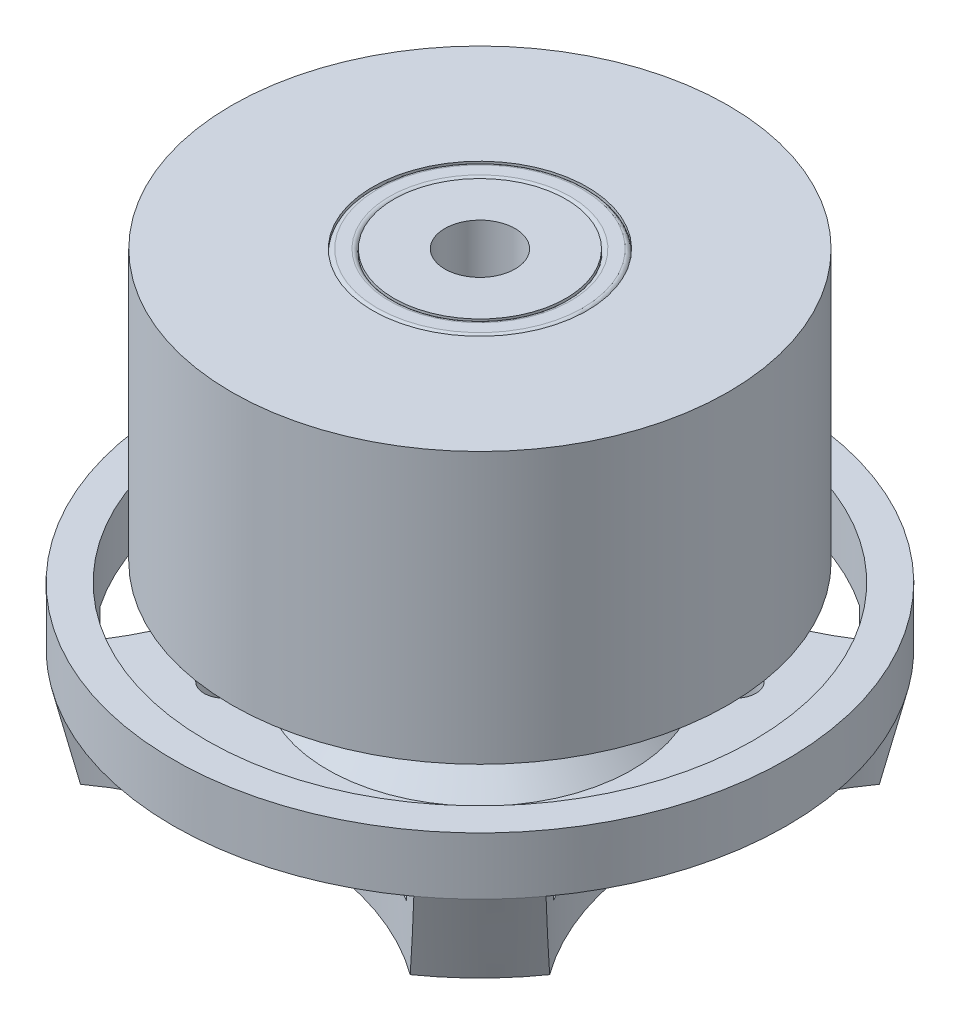
from build123d import *

# Parameters (mm, degrees)
SKETCH2_R                       = 3.4925
CUT_EXTRUDE1_DEPTH              = 5.08
SKETCH3_R                       = 12.460238567
CUT_EXTRUDE2_DEPTH              = 3.6576
CUT_EXTRUDE3_DEPTH              = 1.27
CUT_EXTRUDE3_DEPTH_BACK         = 2.54
SKETCH4_R                       = 12.1158
F_4_40_TAPPED_HOLE1_D           = 1.778
F_4_40_TAPPED_HOLE1_DEPTH       = 2.54
F_4_40_TAPPED_HOLE1_CSINK_D     = 3.175
F_4_40_TAPPED_HOLE1_CSINK_ANGLE = 90
F_4_40_TAPPED_HOLE1_TIP         = 0.53416509
SKETCH13_R                      = 32.431124965
CUT_EXTRUDE5_DEPTH              = 38.213955992
CUT_EXTRUDE6_REACH              = 23.007
SKETCH14_R                      = 1.55575
BOSS_EXTRUDE1_START             = -2.3876
SKETCH15_R                      = 4.75
SKETCH15_R_2                    = 3.81
BOSS_EXTRUDE1_DEPTH             = 19
CHAMFER1_SIZE                   = 2
SKETCH16_R                      = 11
SKETCH16_R_2                    = 4.75
BOSS_EXTRUDE2_DEPTH             = 12
SKETCH17_R                      = 3.81
SKETCH17_R_2                    = 1.55575
BOSS_EXTRUDE3_DEPTH             = 3
FILLET1_R                       = 0.2
FILLET2_R                       = 0.2


with BuildPart() as part:
    # Sketch1 → Revolve1 (revolve)
    with BuildSketch(Plane.XY, mode=Mode.PRIVATE) as revolve1_sk:
        Polygon((0, 11.176), (1.55575, 11.176), (1.55575, 0), (4.445, 0), (4.445, -1.524), (8.89, -1.524), (13.589, -5.08), (13.589, -5.842), (13.843, -5.842), (13.843, -20.4724), (13.589, -20.4724), (13.589, -23.0124), (12.7, -26.67), (3.81, -26.67), (3.81, -26.924), (1.55575, -26.924), (1.55575, -28.956), (0, -28.956), align=None)
    revolve(revolve1_sk.sketch.rotate(Axis((0, -28.956, 0), (0, 1, 0)), 90), axis=Axis((0, -28.956, 0), (0, 1, 0)))

    # Sketch2 → Cut-Extrude1 (cut)
    with BuildSketch(Plane(origin=(0, -1.524, 0), x_dir=(1, 0, 0), z_dir=(0, 1, 0))):
        with Locations(Location((0, 7.9375, 0), (0, 0, 270))):
            Circle(SKETCH2_R)
        with Locations(Location((7.9375, 0, 0), (0, 0, 270))):
            Circle(SKETCH2_R)
        with Locations(Location((0, -7.9375, 0), (0, 0, 270))):
            Circle(SKETCH2_R)
        with Locations(Location((-7.9375, 0, 0), (0, 0, 270))):
            Circle(SKETCH2_R)
    extrude(amount=-CUT_EXTRUDE1_DEPTH, mode=Mode.SUBTRACT)

    # Sketch3 → Cut-Extrude2 (cut)
    with BuildSketch(Plane.XZ.offset(26.67)):
        with Locations((0, 20.486638567)):
            Circle(SKETCH3_R)
        with Locations((-20.486638567, 0)):
            Circle(SKETCH3_R)
        with Locations((0, -20.486638567)):
            Circle(SKETCH3_R)
        with Locations((20.486638567, 0)):
            Circle(SKETCH3_R)
    extrude(amount=-CUT_EXTRUDE2_DEPTH, mode=Mode.SUBTRACT)

    # Sketch4 → Cut-Extrude3 (cut, two sides: drawn at the far end of the back side and taken through both)
    with BuildSketch(Plane.XZ.offset(23.0124).offset(-CUT_EXTRUDE3_DEPTH_BACK)):
        with Locations(Location((0, 0, 0), (0, 0, 124.065321666))):
            Circle(SKETCH4_R)
    extrude(amount=CUT_EXTRUDE3_DEPTH + CUT_EXTRUDE3_DEPTH_BACK, mode=Mode.SUBTRACT)

    # #4-40 Tapped Hole1
    with Locations(Plane(origin=(0, -26.67, 0), x_dir=(-1, 0, 0), z_dir=(0, -1, 0))):
        with Locations((5.666541612, -5.666541612), (-6.672330298, -6.672330298), (-5.666541612, 5.666541612), (6.672330298, 6.672330298)):
            CounterSinkHole(F_4_40_TAPPED_HOLE1_D / 2, F_4_40_TAPPED_HOLE1_CSINK_D / 2, depth=F_4_40_TAPPED_HOLE1_DEPTH, counter_sink_angle=F_4_40_TAPPED_HOLE1_CSINK_ANGLE)
            with Locations((0, 0, -(F_4_40_TAPPED_HOLE1_DEPTH + F_4_40_TAPPED_HOLE1_TIP / 2))):  # 118° drill point
                Cone(0, F_4_40_TAPPED_HOLE1_D / 2, F_4_40_TAPPED_HOLE1_TIP, mode=Mode.SUBTRACT)

    # Sketch13 → Cut-Extrude5 (cut, through all)
    with BuildSketch(Plane.XZ.offset(20.4724)):
        Circle(SKETCH13_R)
    extrude(amount=-CUT_EXTRUDE5_DEPTH, mode=Mode.SUBTRACT)

    # Sketch14 → Cut-Extrude6 (cut, up to next)
    with BuildSketch(Plane.XZ.offset(28.956), mode=Mode.PRIVATE) as cut_extrude6_sk1:
        with Locations(Location((0, 0, 0), (0, 0, 270))):
            Circle(SKETCH14_R)
    cut_extrude6_tool1 = extrude(cut_extrude6_sk1.sketch, amount=-CUT_EXTRUDE6_REACH, mode=Mode.PRIVATE) & part.part
    add(cut_extrude6_tool1.solids().sort_by_distance((0, -28.956, 0))[0], mode=Mode.SUBTRACT)

    # Sketch15 → Boss-Extrude1 (add)
    with BuildSketch(Plane(origin=(0, -24.2824, 0), x_dir=(1, 0, 0), z_dir=(0, 1, 0)).offset(BOSS_EXTRUDE1_START)):
        with Locations(Location((0, 0, 0), (0, 0, 90))):
            Circle(SKETCH15_R)
        with Locations(Location((0, 0, 0), (0, 0, 90))):
            Circle(SKETCH15_R_2, mode=Mode.SUBTRACT)
    extrude(amount=BOSS_EXTRUDE1_DEPTH)

    # Chamfer1
    chamfer1_edges = [part.edges().sort_by_distance(p)[0] for p in [
        (0, -24.2824, 4.75),
    ]]
    chamfer(chamfer1_edges, length=CHAMFER1_SIZE)

    # Fillet1
    fillet1_edges = [part.edges().sort_by_distance(p)[0] for p in [
        (0, -7.67, 4.75),
    ]]
    fillet(fillet1_edges, radius=FILLET1_R)

    # Fillet2
    fillet2_edges = [part.edges().sort_by_distance(p)[0] for p in [
        (0, -7.67, 3.81),
    ]]
    fillet(fillet2_edges, radius=FILLET2_R)


with BuildPart() as body_2:
    # Sketch16 → Boss-Extrude2 (new body)
    with BuildSketch(Plane(origin=(0, -7.67, 0), x_dir=(1, 0, 0), z_dir=(0, 1, 0))):
        with Locations(Location((0, 0, 0), (0, 0, 270))):
            Circle(SKETCH16_R)
        with Locations(Location((0, 0, 0), (0, 0, 270))):
            Circle(SKETCH16_R_2, mode=Mode.SUBTRACT)
    extrude(amount=-BOSS_EXTRUDE2_DEPTH)


with BuildPart() as body_3:
    # Sketch17 → Boss-Extrude3 (new body)
    with BuildSketch(Plane(origin=(0, -7.67, 0), x_dir=(1, 0, 0), z_dir=(0, 1, 0))):
        with Locations(Location((0, 0, 0), (0, 0, 270))):
            Circle(SKETCH17_R)
        with Locations(Location((0, 0, 0), (0, 0, 270))):
            Circle(SKETCH17_R_2, mode=Mode.SUBTRACT)
    extrude(amount=-BOSS_EXTRUDE3_DEPTH)


solid = Compound([part.part, body_2.part, body_3.part])
